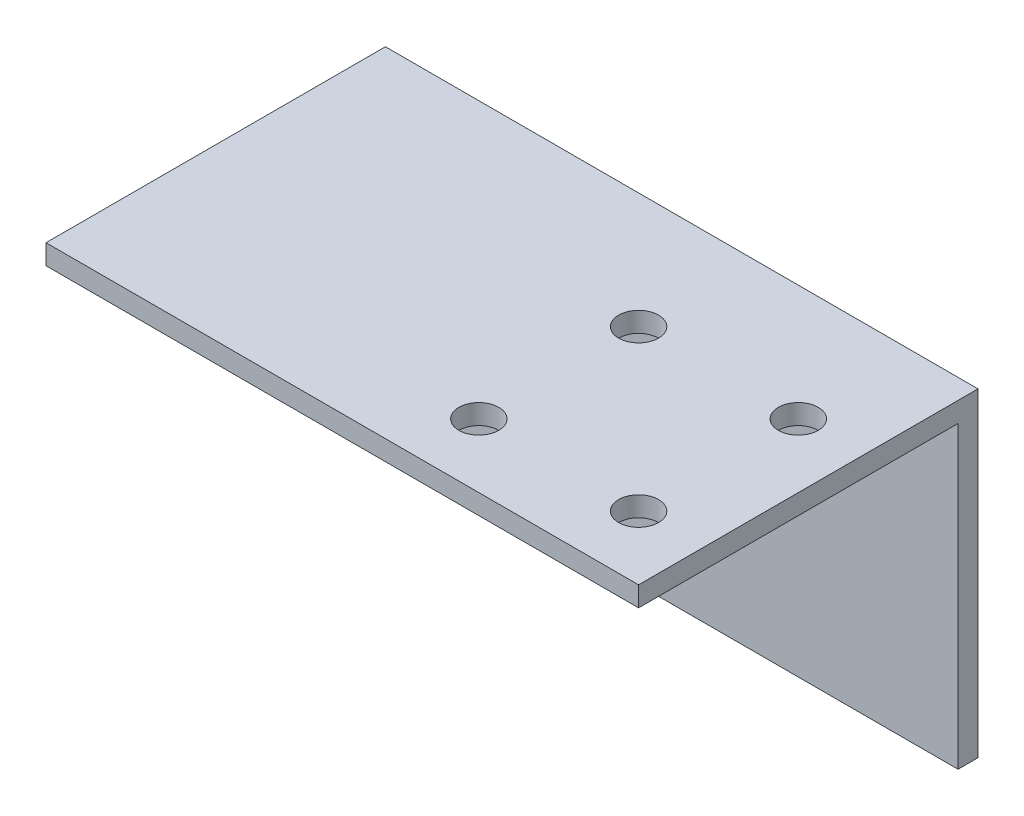
from build123d import *

# Parameters (mm, degrees)
SKETCH1_W           = 94.234
SKETCH1_H           = 50.8
SKETCH1_R           = 4
SKETCH1_R_2         = 2
BOSS_EXTRUDE1_DEPTH = 3.175
SKETCH2_W           = 94.234
SKETCH2_H           = 3.175
BOSS_EXTRUDE2_DEPTH = 50.8
SKETCH3_R           = 3.175
CUT_EXTRUDE1_DEPTH  = 119.581145238


with BuildPart() as part:
    # Sketch1 → Boss-Extrude1 (new body)
    with BuildSketch(Plane.XY):
        with Locations((47.117, 25.4)):
            Rectangle(SKETCH1_W, SKETCH1_H)
        with Locations((22.86, 25.4)):
            Circle(SKETCH1_R, mode=Mode.SUBTRACT)
        with Locations((38.36, 40.9)):
            Circle(SKETCH1_R_2, mode=Mode.SUBTRACT)
        with Locations((38.36, 9.9)):
            Circle(SKETCH1_R_2, mode=Mode.SUBTRACT)
        with Locations((7.36, 40.9)):
            Circle(SKETCH1_R_2, mode=Mode.SUBTRACT)
        with Locations((7.36, 9.9)):
            Circle(SKETCH1_R_2, mode=Mode.SUBTRACT)
    extrude(amount=BOSS_EXTRUDE1_DEPTH)

    # Sketch2 → Boss-Extrude2 (add)
    with BuildSketch(Plane.XY.offset(3.175)):
        with Locations((47.117, 49.2125)):
            Rectangle(SKETCH2_W, SKETCH2_H)
    extrude(amount=BOSS_EXTRUDE2_DEPTH)

    # Sketch3 → Cut-Extrude1 (cut, through all)
    with BuildSketch(Plane.XZ.offset(-47.625)):
        with Locations((84.074, 43.815)):
            Circle(SKETCH3_R)
        with Locations((84.074, 18.415)):
            Circle(SKETCH3_R)
        with Locations((58.674, 43.815)):
            Circle(SKETCH3_R)
        with Locations((58.674, 18.415)):
            Circle(SKETCH3_R)
    extrude(amount=-CUT_EXTRUDE1_DEPTH, mode=Mode.SUBTRACT)


solid = part.part
